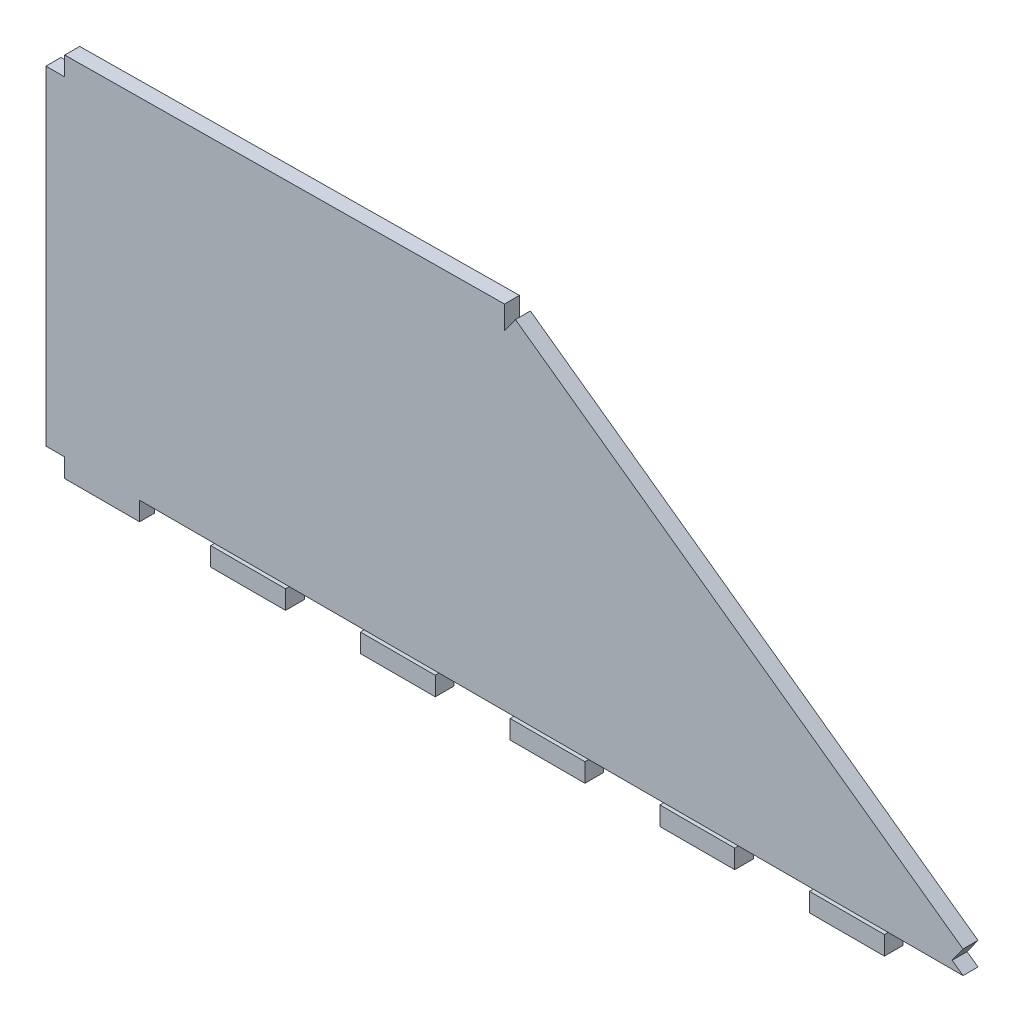
from build123d import *

# Parameters (mm, degrees)
BOSS_EXTRUDE1_DEPTH = 5.08
SKETCH1_4_W         = 25.4
SKETCH1_4_H         = 6.35
BOSS_EXTRUDE2_DEPTH = 6.35
SKETCH1_5_W         = 25.4
SKETCH1_5_H         = 6.35
BOSS_EXTRUDE3_DEPTH = 6.35


with BuildPart() as part:
    # Sketch1 → Boss-Extrude1 (new body)
    with BuildSketch(Plane(origin=(-5.329574036, -16.20301374, 0), x_dir=(1, 0, 0), z_dir=(0, 0, 1))):
        Polygon((-288.637525151, -47.206627274), (-294.987525151, -47.206627274), (-294.987525151, -158.891124316), (-288.637525151, -158.891124316), (-288.637525151, -165.241124316), (-263.237525151, -165.241124316), (-263.237525151, -158.891124316), (16.162474849, -158.891124316), (12.459338773, -156.232709467), (16.162474849, -151.074290795), (-135.709389075, -42.048208602), (-139.412525151, -47.206627274), (-139.412525151, -39.334032086), (-288.637525151, -40.781124316), align=None)
    extrude(amount=BOSS_EXTRUDE1_DEPTH)

    # Sketch1<4> → Boss-Extrude2 (add)
    with BuildSketch(Plane(origin=(-5.329574036, -16.20301374, 0), x_dir=(1, 0, 0), z_dir=(0, 0, 1))):
        with Locations((-225.137525151, -162.066124316)):
            Rectangle(SKETCH1_4_W, SKETCH1_4_H)
        with Locations((-174.337525151, -162.066124316)):
            Rectangle(SKETCH1_4_W, SKETCH1_4_H)
        with Locations((-123.537525151, -162.066124316)):
            Rectangle(SKETCH1_4_W, SKETCH1_4_H)
    extrude(amount=BOSS_EXTRUDE2_DEPTH)

    # Sketch1<5> → Boss-Extrude3 (add)
    with BuildSketch(Plane(origin=(-5.329574036, -16.20301374, 0), x_dir=(1, 0, 0), z_dir=(0, 0, 1))):
        with Locations((-21.937525151, -162.066124316)):
            Rectangle(SKETCH1_5_W, SKETCH1_5_H)
        with Locations((-72.737525151, -162.066124316)):
            Rectangle(SKETCH1_5_W, SKETCH1_5_H)
    extrude(amount=BOSS_EXTRUDE3_DEPTH)


solid = part.part
